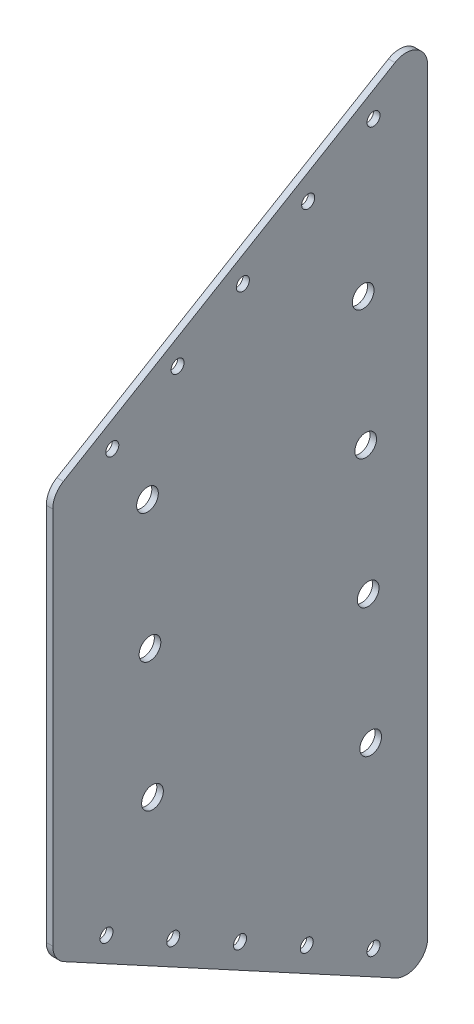
from build123d import *

# Parameters (mm, degrees)
BOSS_EXTRUDE1_DEPTH = 3
CUT_EXTRUDE1_REACH  = 945.397
SKETCH3_R           = 3
CUT_EXTRUDE2_REACH  = 945.397
SKETCH4_R           = 5
FILLET1_R           = 10


with BuildPart() as part:
    # Sketch1 → Boss-Extrude1 (new body)
    with BuildSketch(Plane(origin=(0, 0, 0), x_dir=(0, 0, -1), z_dir=(1, 0, 0))):
        Polygon((459.131022606, 411.733722484), (459.131022606, 597.849507888), (631.946459815, 700.452034157), (631.946459815, 317.945389168), align=None)
    extrude(amount=BOSS_EXTRUDE1_DEPTH)

    # Sketch3 → Cut-Extrude1 (cut, up to next)
    with BuildSketch(Plane(origin=(3, 0, 0), x_dir=(0, 0, -1), z_dir=(1, 0, 0)), mode=Mode.PRIVATE) as cut_extrude1_sk1:
        with Locations((516.660188982, 620.375565005)):
            Circle(SKETCH3_R)
    cut_extrude1_tool1 = extrude(cut_extrude1_sk1.sketch, amount=-CUT_EXTRUDE1_REACH, mode=Mode.PRIVATE) & part.part
    # Sketch3 → Cut-Extrude1 (cut, up to next)
    with BuildSketch(Plane(origin=(3, 0, 0), x_dir=(0, 0, -1), z_dir=(1, 0, 0)), mode=Mode.PRIVATE) as cut_extrude1_sk2:
        with Locations((546.755612593, 638.243566507)):
            Circle(SKETCH3_R)
    cut_extrude1_tool2 = extrude(cut_extrude1_sk2.sketch, amount=-CUT_EXTRUDE1_REACH, mode=Mode.PRIVATE) & part.part
    # Sketch3 → Cut-Extrude1 (cut, up to next)
    with BuildSketch(Plane(origin=(3, 0, 0), x_dir=(0, 0, -1), z_dir=(1, 0, 0)), mode=Mode.PRIVATE) as cut_extrude1_sk3:
        with Locations((576.851036204, 656.111568009)):
            Circle(SKETCH3_R)
    cut_extrude1_tool3 = extrude(cut_extrude1_sk3.sketch, amount=-CUT_EXTRUDE1_REACH, mode=Mode.PRIVATE) & part.part
    # Sketch3 → Cut-Extrude1 (cut, up to next)
    with BuildSketch(Plane(origin=(3, 0, 0), x_dir=(0, 0, -1), z_dir=(1, 0, 0)), mode=Mode.PRIVATE) as cut_extrude1_sk4:
        with Locations((514.66108198, 392.974861297)):
            Circle(SKETCH3_R)
    cut_extrude1_tool4 = extrude(cut_extrude1_sk4.sketch, amount=-CUT_EXTRUDE1_REACH, mode=Mode.PRIVATE) & part.part
    # Sketch3 → Cut-Extrude1 (cut, up to next)
    with BuildSketch(Plane(origin=(3, 0, 0), x_dir=(0, 0, -1), z_dir=(1, 0, 0)), mode=Mode.PRIVATE) as cut_extrude1_sk5:
        with Locations((545.422874592, 376.280188034)):
            Circle(SKETCH3_R)
    cut_extrude1_tool5 = extrude(cut_extrude1_sk5.sketch, amount=-CUT_EXTRUDE1_REACH, mode=Mode.PRIVATE) & part.part
    # Sketch3 → Cut-Extrude1 (cut, up to next)
    with BuildSketch(Plane(origin=(3, 0, 0), x_dir=(0, 0, -1), z_dir=(1, 0, 0)), mode=Mode.PRIVATE) as cut_extrude1_sk6:
        with Locations((576.184667203, 359.585514772)):
            Circle(SKETCH3_R)
    cut_extrude1_tool6 = extrude(cut_extrude1_sk6.sketch, amount=-CUT_EXTRUDE1_REACH, mode=Mode.PRIVATE) & part.part
    # Sketch3 → Cut-Extrude1 (cut, up to next)
    with BuildSketch(Plane(origin=(3, 0, 0), x_dir=(0, 0, -1), z_dir=(1, 0, 0)), mode=Mode.PRIVATE) as cut_extrude1_sk7:
        with Locations((486.564765371, 602.507563503)):
            Circle(SKETCH3_R)
    cut_extrude1_tool7 = extrude(cut_extrude1_sk7.sketch, amount=-CUT_EXTRUDE1_REACH, mode=Mode.PRIVATE) & part.part
    # Sketch3 → Cut-Extrude1 (cut, up to next)
    with BuildSketch(Plane(origin=(3, 0, 0), x_dir=(0, 0, -1), z_dir=(1, 0, 0)), mode=Mode.PRIVATE) as cut_extrude1_sk8:
        with Locations((606.946459815, 673.979569511)):
            Circle(SKETCH3_R)
    cut_extrude1_tool8 = extrude(cut_extrude1_sk8.sketch, amount=-CUT_EXTRUDE1_REACH, mode=Mode.PRIVATE) & part.part
    # Sketch3 → Cut-Extrude1 (cut, up to next)
    with BuildSketch(Plane(origin=(3, 0, 0), x_dir=(0, 0, -1), z_dir=(1, 0, 0)), mode=Mode.PRIVATE) as cut_extrude1_sk9:
        with Locations((483.899289369, 409.669534559)):
            Circle(SKETCH3_R)
    cut_extrude1_tool9 = extrude(cut_extrude1_sk9.sketch, amount=-CUT_EXTRUDE1_REACH, mode=Mode.PRIVATE) & part.part
    # Sketch3 → Cut-Extrude1 (cut, up to next)
    with BuildSketch(Plane(origin=(3, 0, 0), x_dir=(0, 0, -1), z_dir=(1, 0, 0)), mode=Mode.PRIVATE) as cut_extrude1_sk10:
        with Locations((606.946459815, 342.89084151)):
            Circle(SKETCH3_R)
    cut_extrude1_tool10 = extrude(cut_extrude1_sk10.sketch, amount=-CUT_EXTRUDE1_REACH, mode=Mode.PRIVATE) & part.part
    add(cut_extrude1_tool1.solids().sort_by_distance((3, 620.375565, -516.660189))[0], mode=Mode.SUBTRACT)
    add(cut_extrude1_tool2.solids().sort_by_distance((3, 638.243567, -546.755613))[0], mode=Mode.SUBTRACT)
    add(cut_extrude1_tool3.solids().sort_by_distance((3, 656.111568, -576.851036))[0], mode=Mode.SUBTRACT)
    add(cut_extrude1_tool4.solids().sort_by_distance((3, 392.974861, -514.661082))[0], mode=Mode.SUBTRACT)
    add(cut_extrude1_tool5.solids().sort_by_distance((3, 376.280188, -545.422875))[0], mode=Mode.SUBTRACT)
    add(cut_extrude1_tool6.solids().sort_by_distance((3, 359.585515, -576.184667))[0], mode=Mode.SUBTRACT)
    add(cut_extrude1_tool7.solids().sort_by_distance((3, 602.507564, -486.564765))[0], mode=Mode.SUBTRACT)
    add(cut_extrude1_tool8.solids().sort_by_distance((3, 673.97957, -606.94646))[0], mode=Mode.SUBTRACT)
    add(cut_extrude1_tool9.solids().sort_by_distance((3, 409.669535, -483.899289))[0], mode=Mode.SUBTRACT)
    add(cut_extrude1_tool10.solids().sort_by_distance((3, 342.890842, -606.94646))[0], mode=Mode.SUBTRACT)

    # Sketch4 → Cut-Extrude2 (cut, up to next)
    with BuildSketch(Plane(origin=(3, 0, 0), x_dir=(0, 0, -1), z_dir=(1, 0, 0)), mode=Mode.PRIVATE) as cut_extrude2_sk1:
        with Locations((602.186584075, 605.556280319)):
            Circle(SKETCH4_R)
    cut_extrude2_tool1 = extrude(cut_extrude2_sk1.sketch, amount=-CUT_EXTRUDE2_REACH, mode=Mode.PRIVATE) & part.part
    # Sketch4 → Cut-Extrude2 (cut, up to next)
    with BuildSketch(Plane(origin=(3, 0, 0), x_dir=(0, 0, -1), z_dir=(1, 0, 0)), mode=Mode.PRIVATE) as cut_extrude2_sk2:
        with Locations((603.343754952, 545.56744006)):
            Circle(SKETCH4_R)
    cut_extrude2_tool2 = extrude(cut_extrude2_sk2.sketch, amount=-CUT_EXTRUDE2_REACH, mode=Mode.PRIVATE) & part.part
    # Sketch4 → Cut-Extrude2 (cut, up to next)
    with BuildSketch(Plane(origin=(3, 0, 0), x_dir=(0, 0, -1), z_dir=(1, 0, 0)), mode=Mode.PRIVATE) as cut_extrude2_sk3:
        with Locations((604.50092583, 485.578599802)):
            Circle(SKETCH4_R)
    cut_extrude2_tool3 = extrude(cut_extrude2_sk3.sketch, amount=-CUT_EXTRUDE2_REACH, mode=Mode.PRIVATE) & part.part
    # Sketch4 → Cut-Extrude2 (cut, up to next)
    with BuildSketch(Plane(origin=(3, 0, 0), x_dir=(0, 0, -1), z_dir=(1, 0, 0)), mode=Mode.PRIVATE) as cut_extrude2_sk4:
        with Locations((605.658096708, 425.589759543)):
            Circle(SKETCH4_R)
    cut_extrude2_tool4 = extrude(cut_extrude2_sk4.sketch, amount=-CUT_EXTRUDE2_REACH, mode=Mode.PRIVATE) & part.part
    # Sketch4 → Cut-Extrude2 (cut, up to next)
    with BuildSketch(Plane(origin=(3, 0, 0), x_dir=(0, 0, -1), z_dir=(1, 0, 0)), mode=Mode.PRIVATE) as cut_extrude2_sk5:
        with Locations((502.774290496, 574.124621037)):
            Circle(SKETCH4_R)
    cut_extrude2_tool5 = extrude(cut_extrude2_sk5.sketch, amount=-CUT_EXTRUDE2_REACH, mode=Mode.PRIVATE) & part.part
    # Sketch4 → Cut-Extrude2 (cut, up to next)
    with BuildSketch(Plane(origin=(3, 0, 0), x_dir=(0, 0, -1), z_dir=(1, 0, 0)), mode=Mode.PRIVATE) as cut_extrude2_sk6:
        with Locations((503.931461374, 514.135780779)):
            Circle(SKETCH4_R)
    cut_extrude2_tool6 = extrude(cut_extrude2_sk6.sketch, amount=-CUT_EXTRUDE2_REACH, mode=Mode.PRIVATE) & part.part
    # Sketch4 → Cut-Extrude2 (cut, up to next)
    with BuildSketch(Plane(origin=(3, 0, 0), x_dir=(0, 0, -1), z_dir=(1, 0, 0)), mode=Mode.PRIVATE) as cut_extrude2_sk7:
        with Locations((505.088632251, 454.14694052)):
            Circle(SKETCH4_R)
    cut_extrude2_tool7 = extrude(cut_extrude2_sk7.sketch, amount=-CUT_EXTRUDE2_REACH, mode=Mode.PRIVATE) & part.part
    add(cut_extrude2_tool1.solids().sort_by_distance((3, 605.55628, -602.186584))[0], mode=Mode.SUBTRACT)
    add(cut_extrude2_tool2.solids().sort_by_distance((3, 545.56744, -603.343755))[0], mode=Mode.SUBTRACT)
    add(cut_extrude2_tool3.solids().sort_by_distance((3, 485.5786, -604.500926))[0], mode=Mode.SUBTRACT)
    add(cut_extrude2_tool4.solids().sort_by_distance((3, 425.58976, -605.658097))[0], mode=Mode.SUBTRACT)
    add(cut_extrude2_tool5.solids().sort_by_distance((3, 574.124621, -502.77429))[0], mode=Mode.SUBTRACT)
    add(cut_extrude2_tool6.solids().sort_by_distance((3, 514.135781, -503.931461))[0], mode=Mode.SUBTRACT)
    add(cut_extrude2_tool7.solids().sort_by_distance((3, 454.146941, -505.088632))[0], mode=Mode.SUBTRACT)

    # Fillet1
    fillet1_edges = [part.edges().sort_by_distance(p)[0] for p in [
        (1.5, 597.849507888, -459.131022606),
        (1.5, 411.733722484, -459.131022606),
        (1.5, 317.945389168, -631.946459815),
        (1.5, 700.452034157, -631.946459815),
    ]]
    fillet(fillet1_edges, radius=FILLET1_R)


solid = part.part
